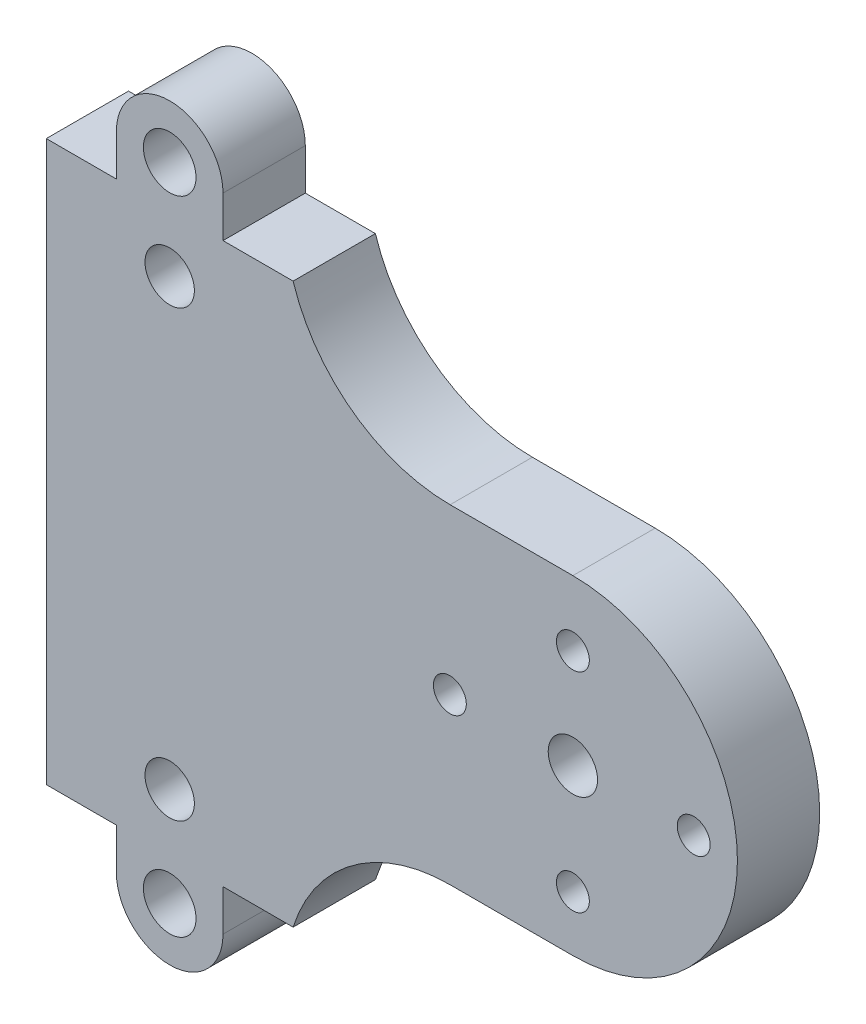
from build123d import *

# Parameters (mm, degrees)
ESQUISSE1_R             = 1
ESQUISSE1_R_2           = 1.5
BOSS_EXTRU_1_DEPTH      = 5
ENL_V_MAT_EXTRU_1_DEPTH = 5
ESQUISSE3_W             = 20
ESQUISSE3_H             = 34
BOSS_EXTRU_2_DEPTH      = 5
ESQUISSE4_R             = 1.5
ESQUISSE4_W             = 9.798464728
ESQUISSE4_H             = 39.858161606
ENL_V_MAT_EXTRU_2_DEPTH = 5
ESQUISSE5_W             = 2.5
ESQUISSE5_H             = 34
BOSS_EXTRU_3_DEPTH      = 5
ESQUISSE6_R             = 1.6
BOSS_EXTRU_4_DEPTH      = 5
ESQUISSE8_W             = 43.131619687
ESQUISSE8_H             = 48.78573065
ESQUISSE8_W_2           = 13.204377845
ESQUISSE8_H_2           = 47.447309867
ENL_V_MAT_EXTRU_3_DEPTH = 10
ESQUISSE9_R             = 1.5
ESQUISSE9_R_2           = 1
BOSS_EXTRU_5_DEPTH      = 5
CONG_1_R                = 10


with BuildPart() as part:
    # Esquisse1 → Boss.-Extru.1 (new body)
    with BuildSketch(Plane.XY):
        with BuildLine():
            Line((-13.584596858, -30.047129187), (-13.584596858, -25.547129187))
            Line((-13.584596858, -25.547129187), (-13.584596858, -25.297129187))
            Line((-13.584596858, -25.297129187), (-13.834596858, -25.297129187))
            Line((-13.834596858, -25.297129187), (-16.334596858, -25.297129187))
            Line((-16.334596858, -25.297129187), (-16.584596858, -25.297129187))
            Line((-16.584596858, -25.297129187), (-16.584596858, -25.047129187))
            Line((-16.584596858, -25.047129187), (-16.584596858, 6.452870813))
            Line((-16.584596858, 6.452870813), (-16.584596858, 6.702870813))
            Line((-16.584596858, 6.702870813), (-16.334596858, 6.702870813))
            Line((-16.334596858, 6.702870813), (-13.834596858, 6.702870813))
            Line((-13.834596858, 6.702870813), (-13.584596858, 6.702870813))
            Line((-13.584596858, 6.702870813), (-13.584596858, 6.952870813))
            Line((-13.584596858, 6.952870813), (-13.584596858, 11.452870813))
            Line((-13.584596858, 11.452870813), (-13.584596858, 11.702870813))
            Line((-13.584596858, 11.702870813), (-13.334596858, 11.702870813))
            Line((-13.334596858, 11.702870813), (-8.584596858, 11.702870813))
            Line((-8.584596858, 11.702870813), (-8.584596858, 6.702870813))
            Line((-8.584596858, 6.702870813), (-7.491776281, 6.702870813))
            Line((-7.491776281, 6.702870813), (-4.034541178, 6.702870813))
            ThreePointArc((-4.034541178, 6.702870813), (-0.161557832, 6.19424756), (3.448773595, 4.702870813))
            ThreePointArc((3.448773595, 4.702870813), (10.66943645, 1.720117321), (18.415403142, 0.702870813))
            ThreePointArc((18.415403142, 0.702870813), (28.415403142, -9.297129187), (18.415403142, -19.297129187))
            ThreePointArc((18.415403142, -19.297129187), (10.66943645, -20.314375694), (3.448773595, -23.297129187))
            ThreePointArc((3.448773595, -23.297129187), (-0.161557832, -24.788505933), (-4.034541178, -25.297129187))
            Line((-4.034541178, -25.297129187), (-7.491776281, -25.297129187))
            Line((-7.491776281, -25.297129187), (-8.584596858, -25.297129187))
            Line((-8.584596858, -25.297129187), (-8.584596858, -30.297129187))
            Line((-8.584596858, -30.297129187), (-13.334596858, -30.297129187))
            Line((-13.334596858, -30.297129187), (-13.584596858, -30.297129187))
            Line((-13.584596858, -30.297129187), (-13.584596858, -30.047129187))
        make_face()
        with Locations((18.477857718, -2.297129187)):
            Circle(ESQUISSE1_R, mode=Mode.SUBTRACT)
        with Locations((25.415403142, -9.359583762)):
            Circle(ESQUISSE1_R, mode=Mode.SUBTRACT)
        with Locations((18.415403142, -9.297129187)):
            Circle(ESQUISSE1_R_2, mode=Mode.SUBTRACT)
        with Locations((11.415403142, -9.234674611)):
            Circle(ESQUISSE1_R, mode=Mode.SUBTRACT)
        with Locations((18.352948567, -16.297129187)):
            Circle(ESQUISSE1_R, mode=Mode.SUBTRACT)
    extrude(amount=BOSS_EXTRU_1_DEPTH)

    # Esquisse2 → Enlèv. mat.-Extru.1 (cut)
    with BuildSketch(Plane(origin=(0, 0, 0), x_dir=(-1, 0, 0), z_dir=(0, 0, -1))):
        Polygon((1.584596858, -19.297129187), (1.584596858, -25.297129187), (1.584596858, -26.297129187), (21.584596858, -26.297129187), (21.584596858, -33.65697819), (-26.833247513, -33.65697819), (-26.198667142, -19.297129187), align=None)
        Polygon((21.584596858, 7.702870813), (1.584596858, 7.702870813), (1.584596858, 6.702870813), (1.584596858, 0.702870813), (-26.198667142, 0.702870813), (-26.833247513, 15.062719816), (21.584596858, 15.062719816), align=None)
    extrude(amount=-ENL_V_MAT_EXTRU_1_DEPTH, mode=Mode.SUBTRACT)

    # Esquisse3 → Boss.-Extru.2 (add)
    with BuildSketch(Plane(origin=(0, 0, 0), x_dir=(-1, 0, 0), z_dir=(0, 0, -1))):
        with Locations((11.584596858, -9.297129187)):
            Rectangle(ESQUISSE3_W, ESQUISSE3_H)
    extrude(amount=-BOSS_EXTRU_2_DEPTH)

    # Esquisse4 → Enlèv. mat.-Extru.2 (cut)
    with BuildSketch(Plane(origin=(0, 0, 0), x_dir=(-1, 0, 0), z_dir=(0, 0, -1))):
        with Locations((9.084596858, -22.797129187)):
            Circle(ESQUISSE4_R)
        with Locations((9.084596858, 4.202870813)):
            Circle(ESQUISSE4_R)
        with Locations((23.983829222, -9.020336398)):
            Rectangle(ESQUISSE4_W, ESQUISSE4_H)
    extrude(amount=-ENL_V_MAT_EXTRU_2_DEPTH, mode=Mode.SUBTRACT)

    # Esquisse5 → Boss.-Extru.3 (add)
    with BuildSketch(Plane(origin=(0, 0, 0), x_dir=(-1, 0, 0), z_dir=(0, 0, -1))):
        with Locations((0.334596858, -9.297129187)):
            Rectangle(ESQUISSE5_W, ESQUISSE5_H)
    extrude(amount=-BOSS_EXTRU_3_DEPTH)

    # Esquisse6 → Boss.-Extru.4 (add)
    # profile 1 of 2: a face of its own
    with BuildSketch(Plane(origin=(0, 0, 0), x_dir=(-1, 0, 0), z_dir=(0, 0, -1))):
        with BuildLine():
            Line((12.324596858, -25.12480516), (5.844596858, -25.12480516))
            Line((5.844596858, -25.12480516), (5.844596858, -28.797129187))
            ThreePointArc((5.844596858, -28.797129187), (9.084596858, -32.037129187), (12.324596858, -28.797129187))
            Line((12.324596858, -28.797129187), (12.324596858, -25.12480516))
        make_face()
        with Locations((9.084596858, -28.797129187)):
            Circle(ESQUISSE6_R, mode=Mode.SUBTRACT)
    # profile 2 of 2: a face of its own
    with BuildSketch(Plane(origin=(0, 0, 0), x_dir=(-1, 0, 0), z_dir=(0, 0, -1))):
        with BuildLine():
            Line((12.324596858, 6.757738308), (5.844596858, 6.757738308))
            Line((5.844596858, 6.757738308), (5.844596858, 10.202870813))
            ThreePointArc((5.844596858, 10.202870813), (9.084596858, 13.442870813), (12.324596858, 10.202870813))
            Line((12.324596858, 10.202870813), (12.324596858, 6.757738308))
        make_face()
        with Locations((9.084596858, 10.202870813)):
            Circle(ESQUISSE6_R, mode=Mode.SUBTRACT)
    extrude(amount=-BOSS_EXTRU_4_DEPTH)

    # Esquisse8 → Enlèv. mat.-Extru.3 (cut)
    with BuildSketch(Plane(origin=(0, 0, 0), x_dir=(-1, 0, 0), z_dir=(0, 0, -1))):
        with Locations((-19.981212986, -14.067924119)):
            Rectangle(ESQUISSE8_W, ESQUISSE8_H)
        with Locations((23.186785781, -15.322061454)):
            Rectangle(ESQUISSE8_W_2, ESQUISSE8_H_2)
    extrude(amount=-ENL_V_MAT_EXTRU_3_DEPTH, mode=Mode.SUBTRACT)

    # Esquisse9 → Boss.-Extru.5 (add)
    with BuildSketch(Plane(origin=(0, 0, 0), x_dir=(-1, 0, 0), z_dir=(0, 0, -1))):
        with BuildLine():
            Line((-15.415403142, -19.297129187), (1.584596858, -19.297129187))
            Line((1.584596858, -19.297129187), (1.584596858, 0.702870813))
            Line((1.584596858, 0.702870813), (-15.415403142, 0.702870813))
            ThreePointArc((-15.415403142, 0.702870813), (-25.415403142, -9.297129187), (-15.415403142, -19.297129187))
        make_face()
        with Locations((-15.415403142, -9.297129187)):
            Circle(ESQUISSE9_R, mode=Mode.SUBTRACT)
        with Locations((-15.415403142, -15.934238111)):
            Circle(ESQUISSE9_R_2, mode=Mode.SUBTRACT)
        with Locations((-22.758101932, -9.297129187)):
            Circle(ESQUISSE9_R_2, mode=Mode.SUBTRACT)
        with Locations((-15.415403142, -3.255710211)):
            Circle(ESQUISSE9_R_2, mode=Mode.SUBTRACT)
        with Locations((-7.938498128, -9.297129187)):
            Circle(ESQUISSE9_R_2, mode=Mode.SUBTRACT)
    extrude(amount=-BOSS_EXTRU_5_DEPTH)

    # Congé1
    # the kernel refuses this fillet: 10 mm, written as the material it adds along each edge
    with BuildSketch(Plane(origin=(-1.584596858, 0.702870813, 0), x_dir=(0, 1, 0), z_dir=(0, 0, 1))) as cong_1_piece_1:
        with BuildLine():
            CenterArc((10, -9.539392014), CONG_1_R, 107.457603124, 72.542396876)
            Line((0, -9.539392014), (-0.2, -9.539392014))
            Line((-0.2, -9.539392014), (-0.2, 0))
            Line((-0.2, 0), (0, 0.2))
            ThreePointArc((0, 0.2), (3.5, 0.2), (6.94, 0.19078784))
            Line((6.94, 0.19078784), (7, 0))
        make_face()
    extrude(amount=5)
    with BuildSketch(Plane(origin=(-1.584596858, -19.297129187, 0), x_dir=(0, -1, 0), z_dir=(0, 0, 1))) as cong_1_piece_2:
        with BuildLine():
            CenterArc((10, 9.539392014), CONG_1_R, 180, 72.542396876)
            Line((0, 9.539392014), (-0.2, 9.539392014))
            Line((-0.2, 9.539392014), (-0.2, 0))
            Line((-0.2, 0), (0, -0.2))
            ThreePointArc((0, -0.2), (3.5, -0.2), (6.94, -0.19078784))
            Line((6.94, -0.19078784), (7, 0))
        make_face()
    extrude(amount=5)


solid = part.part
